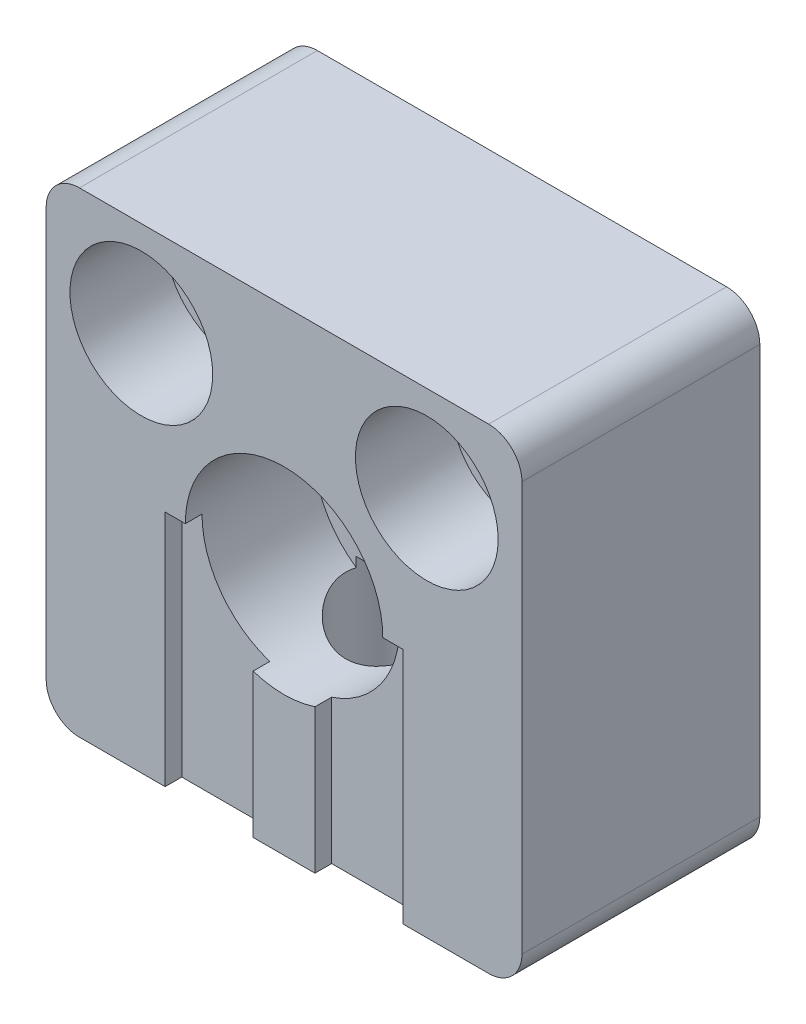
from build123d import *

# Parameters (mm, degrees)
SKETCH1_W           = 10
SKETCH1_H           = 5
BOSS_EXTRUDE1_DEPTH = 10
SKETCH2_R           = 1.575
CUT_EXTRUDE1_DEPTH  = 16
SKETCH3_R           = 2.075
CUT_EXTRUDE2_DEPTH  = 2.7
SKETCH5_W           = 1.85
SKETCH5_H           = 0.35
CUT_EXTRUDE3_DEPTH  = 5
SKETCH6_R           = 1.5
CUT_EXTRUDE4_DEPTH  = 2
SKETCH8_R           = 1.2
CUT_EXTRUDE5_DEPTH  = 3.5
FILLET1_R           = 0.7


with BuildPart() as part:
    # Sketch1 → Boss-Extrude1 (new body)
    with BuildSketch(Plane(origin=(0, 0, 0), x_dir=(1, 0, 0), z_dir=(0, 1, 0))):
        with Locations((5, 2.5)):
            Rectangle(SKETCH1_W, SKETCH1_H)
    extrude(amount=BOSS_EXTRUDE1_DEPTH)

    # Sketch2 → Cut-Extrude1 (cut, through all)
    with BuildSketch(Plane.XY):
        with Locations((5, 5)):
            Circle(SKETCH2_R)
    extrude(amount=-CUT_EXTRUDE1_DEPTH, mode=Mode.SUBTRACT)

    # Sketch3 → Cut-Extrude2 (cut)
    with BuildSketch(Plane.XY):
        with Locations((5, 5)):
            Circle(SKETCH3_R)
    extrude(amount=-CUT_EXTRUDE2_DEPTH, mode=Mode.SUBTRACT)

    # Sketch5 → Cut-Extrude3 (cut)
    with BuildSketch(Plane.XZ):
        with Locations((3.425, -0.175)):
            Rectangle(SKETCH5_W, SKETCH5_H)
        with Locations((6.575, -0.175)):
            Rectangle(SKETCH5_W, SKETCH5_H)
    extrude(amount=-CUT_EXTRUDE3_DEPTH, mode=Mode.SUBTRACT)

    # Sketch6 → Cut-Extrude4 (cut)
    with BuildSketch(Plane.XY):
        with Locations((2, 8)):
            Circle(SKETCH6_R)
        with Locations((8, 8)):
            Circle(SKETCH6_R)
    extrude(amount=-CUT_EXTRUDE4_DEPTH, mode=Mode.SUBTRACT)

    # Sketch8 → Cut-Extrude5 (cut)
    with BuildSketch(Plane.XZ):
        with Locations((5, -2.5)):
            Circle(SKETCH8_R)
    extrude(amount=-CUT_EXTRUDE5_DEPTH, mode=Mode.SUBTRACT)

    # Fillet1
    fillet1_edges = [part.edges().sort_by_distance(p)[0] for p in [
        (0, 10, -2.5),
        (0, 0, -2.5),
        (10, 0, -2.5),
        (10, 10, -2.5),
    ]]
    fillet(fillet1_edges, radius=FILLET1_R)


solid = part.part
